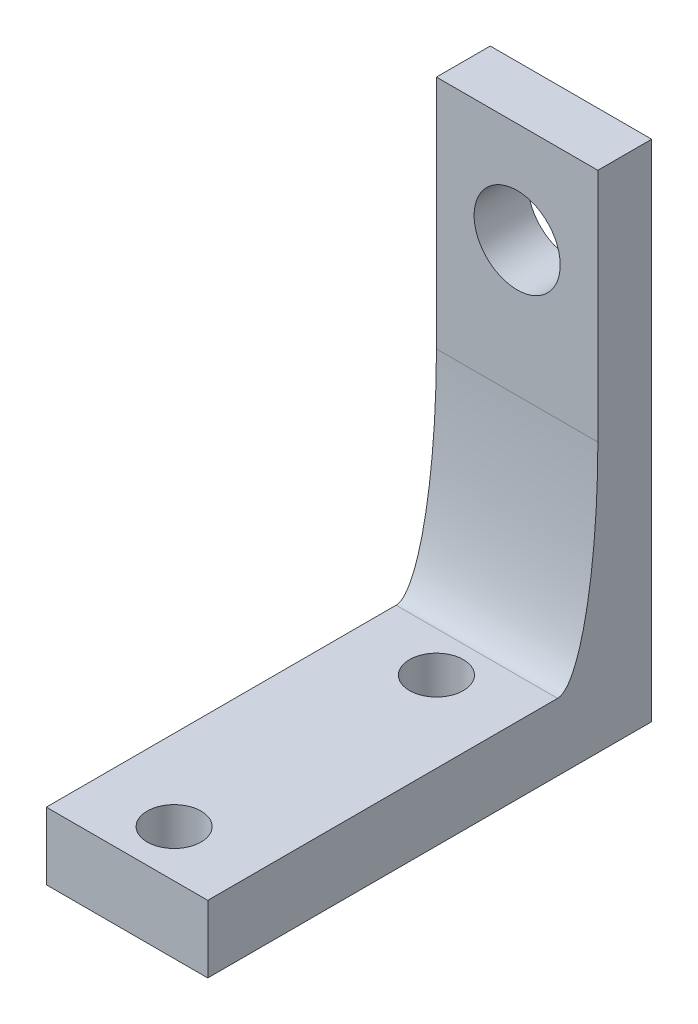
from build123d import *

# Parameters (mm, degrees)
SKETCH1_W           = 12
SKETCH1_H           = 32.5
SKETCH1_R           = 3.2
BOSS_EXTRUDE1_DEPTH = 4
SKETCH2_W           = 12
SKETCH2_H           = 33
SKETCH2_R           = 2
BOSS_EXTRUDE2_DEPTH = 5
FILLET1_SIZE        = 15
FILLET1_SIZE_2      = 3


with BuildPart() as part:
    # Sketch1 → Boss-Extrude1 (new body)
    with BuildSketch(Plane.XY):
        with Locations((6, 16.25)):
            Rectangle(SKETCH1_W, SKETCH1_H)
        with Locations((6, 25)):
            Circle(SKETCH1_R, mode=Mode.SUBTRACT)
    extrude(amount=BOSS_EXTRUDE1_DEPTH)

    # Sketch2 → Boss-Extrude2 (add)
    with BuildSketch(Plane.XZ):
        with Locations((6, 16.5)):
            Rectangle(SKETCH2_W, SKETCH2_H)
        with Locations(Location((6, 10, 0), (0, 0, 270))):
            Circle(SKETCH2_R, mode=Mode.SUBTRACT)
        with Locations(Location((6, 29.5, 0), (0, 0, 270))):
            Circle(SKETCH2_R, mode=Mode.SUBTRACT)
    extrude(amount=BOSS_EXTRUDE2_DEPTH)

    # Fillet1
    # an asymmetric fillet: 15, 3 mm, written as the material it adds along each edge
    with BuildSketch(Plane(origin=(0, 0, 4), x_dir=(0, 1, 0), z_dir=(1, 0, 0))) as fillet1_piece_1:
        with BuildLine():
            Bezier((FILLET1_SIZE, 0), (0, 0), (0, FILLET1_SIZE_2), weights=[1, 0.707106781, 1])
            Line((0, FILLET1_SIZE_2), (0, 0))
            Line((0, 0), (FILLET1_SIZE, 0))
        make_face()
    extrude(amount=12)


solid = part.part
